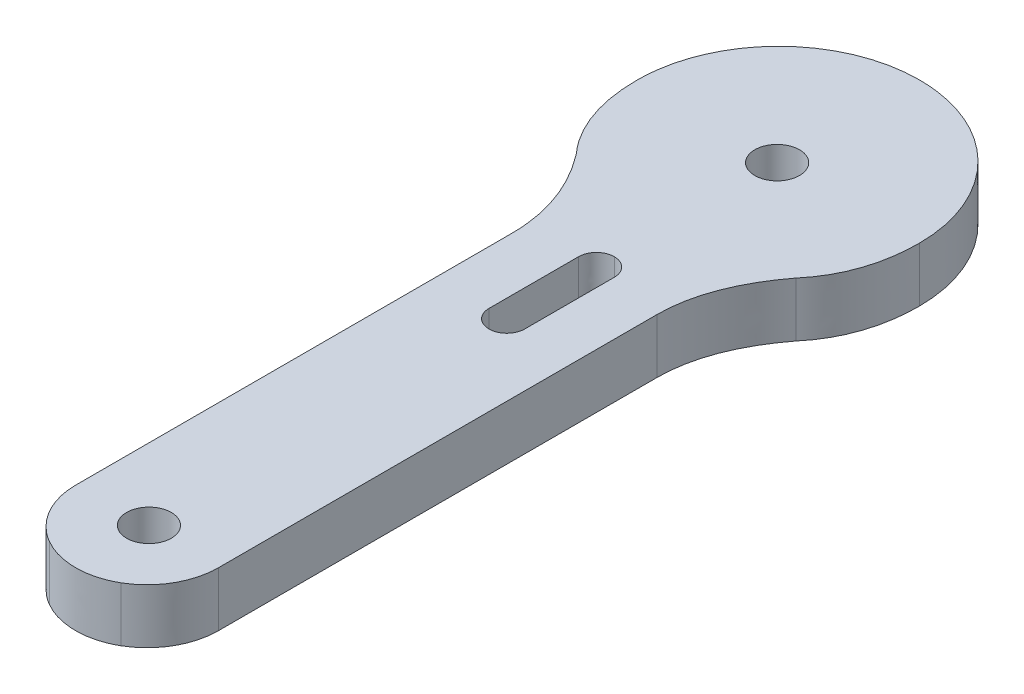
from build123d import *

# Parameters (mm, degrees)
SKETCH1_R           = 1.25
BOSS_EXTRUDE1_DEPTH = 3.048


with BuildPart() as part:
    # Sketch1 → Boss-Extrude1 (new body)
    with BuildSketch(Plane(origin=(0, 0, 0), x_dir=(1, 0, 0), z_dir=(0, 1, 0))):
        with BuildLine():
            Line((-5.764491141, 4.265941007), (-5.764157665, -20.236820987))
            add(Edge.make_bspline(
                [(-5.764157665, -20.236820987), (-5.764157665, -21.665982325), (-6.525136423, -22.986581467), (-7.760615558, -23.701064473)],
                knots=[3, 3, 3, 3, 4, 4, 4, 4], degree=3))
            add(Edge.make_bspline(
                [(-7.760615558, -23.701064473), (-8.995904595, -24.415723273), (-10.518052208, -24.415723273), (-11.753531343, -23.701064473)],
                knots=[4, 4, 4, 4, 5, 5, 5, 5], degree=3))
            add(Edge.make_bspline(
                [(-11.753531343, -23.701064473), (-12.989010479, -22.986581467), (-13.749989236, -21.665982325), (-13.749989236, -20.236820987)],
                knots=[5, 5, 5, 5, 6, 6, 6, 6], degree=3))
            Line((-13.749989236, -20.236820987), (-13.749989236, 4.117246102))
            add(Edge.make_bspline(
                [(-13.749989236, 4.117246102), (-13.749989236, 5.810878855), (-14.234647696, 7.739449731), (-15.779412151, 9.7615427)],
                knots=[7, 7, 7, 7, 8, 8, 8, 8], degree=3))
            add(Edge.make_bspline(
                [(-15.779412151, 9.7615427), (-16.931964489, 11.036572284), (-17.667065484, 12.796303359), (-17.667065484, 15.040364803)],
                knots=[8, 8, 8, 8, 9, 9, 9, 9], degree=3))
            add(Edge.make_bspline(
                [(-17.667065484, 15.040364803), (-17.667065484, 19.405412775), (-14.13466078, 22.94460285), (-9.777199515, 22.944212198)],
                knots=[9, 9, 9, 9, 10, 10, 10, 10], degree=3))
            add(Edge.make_bspline(
                [(-9.777199515, 22.944212198), (-5.420055081, 22.944212198), (-1.887455404, 19.405412774), (-1.887650377, 15.040052281)],
                knots=[10, 10, 10, 10, 11, 11, 11, 11], degree=3))
            add(Edge.make_bspline(
                [(-1.887650377, 15.040052281), (-1.887650378, 12.87963879), (-2.569424151, 11.167912772), (-3.649012115, 9.905491182)],
                knots=[11, 11, 11, 11, 11.966366877, 11.966366877, 11.966366877, 11.966366877], degree=3))
            add(Edge.make_bspline(
                [(-3.649012115, 9.905491182), (-5.193839936, 7.883476344), (-5.764491141, 5.959378434), (-5.764491141, 4.265941007)],
                knots=[1, 1, 1, 1, 2, 2, 2, 2], degree=3))
        make_face()
        with Locations((-9.757105134, -20.136853136)):
            Circle(SKETCH1_R, mode=Mode.SUBTRACT)
        with Locations((-9.757168498, 14.963757942)):
            Circle(SKETCH1_R, mode=Mode.SUBTRACT)
        with BuildLine():
            Line((-10.755334079, 4.863274258), (-10.755334079, -0.136934827))
            add(Edge.make_bspline(
                [(-10.755334079, -0.136934827), (-10.755334079, -0.494147031), (-10.564948034, -0.824404246), (-10.256042912, -1.003108011)],
                knots=[1, 1, 1, 1, 2, 2, 2, 2], degree=3))
            add(Edge.make_bspline(
                [(-10.256042912, -1.003108011), (-9.947396128, -1.18161645), (-9.566750771, -1.18161645), (-9.257977255, -1.003108011)],
                knots=[2, 2, 2, 2, 3, 3, 3, 3], degree=3))
            add(Edge.make_bspline(
                [(-9.257977255, -1.003108011), (-8.949198865, -0.824404246), (-8.758876186, -0.494147031), (-8.758876186, -0.136934827)],
                knots=[3, 3, 3, 3, 4, 4, 4, 4], degree=3))
            Line((-8.758876186, -0.136934827), (-8.758876186, 4.863274258))
            add(Edge.make_bspline(
                [(-8.758876186, 4.863274258), (-8.758876186, 5.415519481), (-9.205778168, 5.863284823), (-9.757073449, 5.863284823)],
                knots=[5, 5, 5, 5, 6, 6, 6, 6], degree=3))
            add(Edge.make_bspline(
                [(-9.757073449, 5.863284823), (-10.308368731, 5.863284823), (-10.755334079, 5.415519481), (-10.755334079, 4.863274258)],
                knots=[6, 6, 6, 6, 7, 7, 7, 7], degree=3))
        make_face(mode=Mode.SUBTRACT)
    extrude(amount=BOSS_EXTRUDE1_DEPTH)


solid = part.part
